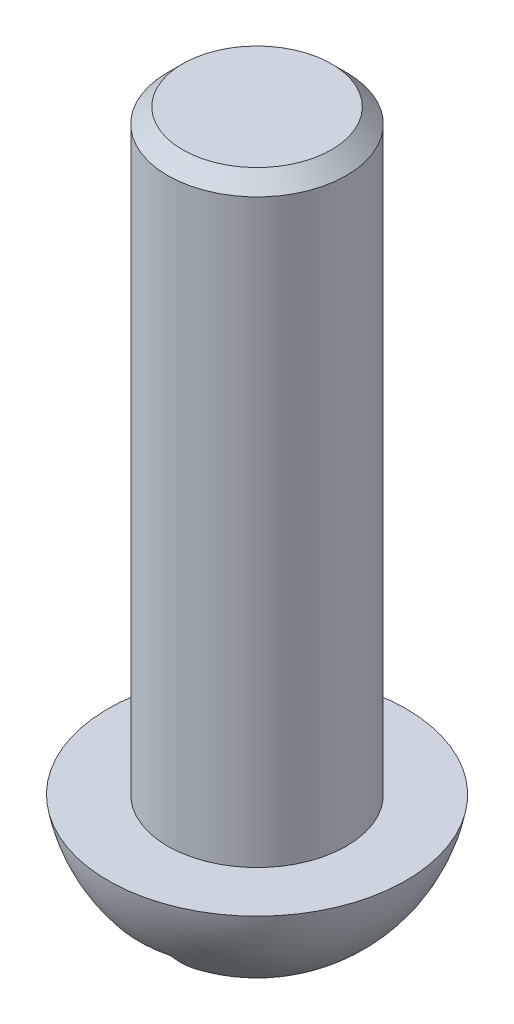
from build123d import *

# Parameters (mm, degrees)
SKETCH1_R               = 3
BOSS_EXTRUDE1_DEPTH     = 20
CHAMFER1_SIZE           = 0.5
CUT_EXTRUDE1_DEPTH      = 22.213203483
CUT_EXTRUDE1_DEPTH_BACK = 22.213203483


with BuildPart() as part:
    # Sketch1 → Boss-Extrude1 (new body)
    with BuildSketch(Plane(origin=(0, 0, 0), x_dir=(1, 0, 0), z_dir=(0, 1, 0))):
        Circle(SKETCH1_R)
    extrude(amount=BOSS_EXTRUDE1_DEPTH)

    # Chamfer1
    chamfer1_edges = [part.edges().sort_by_distance(p)[0] for p in [
        (-3, 20, 0),
    ]]
    chamfer(chamfer1_edges, length=CHAMFER1_SIZE)

    # Sketch2 → Revolve1 (revolve)
    with BuildSketch(Plane.XY):
        with BuildLine():
            Line((0, 0), (-5, 0))
            ThreePointArc((-5, 0), (-3.260312474, -3.005133898), (0, -4.2))
            Line((0, -4.2), (0, 0))
        make_face()
    revolve(axis=Axis((0, -4.2, 0), (0, 1, 0)))

    # Sketch3 → Cut-Extrude1 (cut, two sides: drawn at the far end of the back side and taken through both)
    with BuildSketch(Plane.XY.offset(-CUT_EXTRUDE1_DEPTH_BACK)):
        Polygon((-0.955, -2.29), (0, -2.29), (0.955, -2.29), (0.955, -6.2280618), (-0.955, -6.2280618), align=None)
    extrude(amount=CUT_EXTRUDE1_DEPTH + CUT_EXTRUDE1_DEPTH_BACK, mode=Mode.SUBTRACT)


solid = part.part
